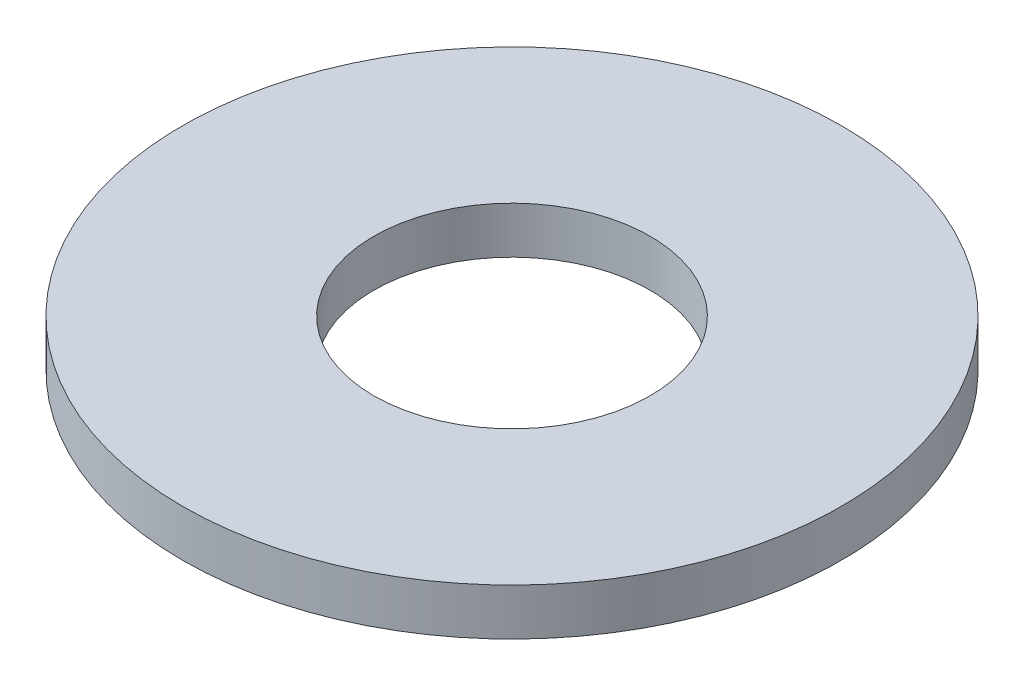
from build123d import *

# Parameters (mm, degrees)
SKETCH1_R           = 77.5
BOSS_EXTRUDE1_DEPTH = 11
SKETCH2_R           = 32.5
CUT_EXTRUDE1_DEPTH  = 111.152167478


with BuildPart() as part:
    # Sketch1 → Boss-Extrude1 (new body)
    with BuildSketch(Plane(origin=(0, 0, 0), x_dir=(1, 0, 0), z_dir=(0, 1, 0))):
        Circle(SKETCH1_R)
    extrude(amount=BOSS_EXTRUDE1_DEPTH)

    # Sketch2 → Cut-Extrude1 (cut, through all)
    with BuildSketch(Plane(origin=(0, 0, 0), x_dir=(1, 0, 0), z_dir=(0, 1, 0))):
        Circle(SKETCH2_R)
    extrude(amount=CUT_EXTRUDE1_DEPTH, mode=Mode.SUBTRACT)


solid = part.part
